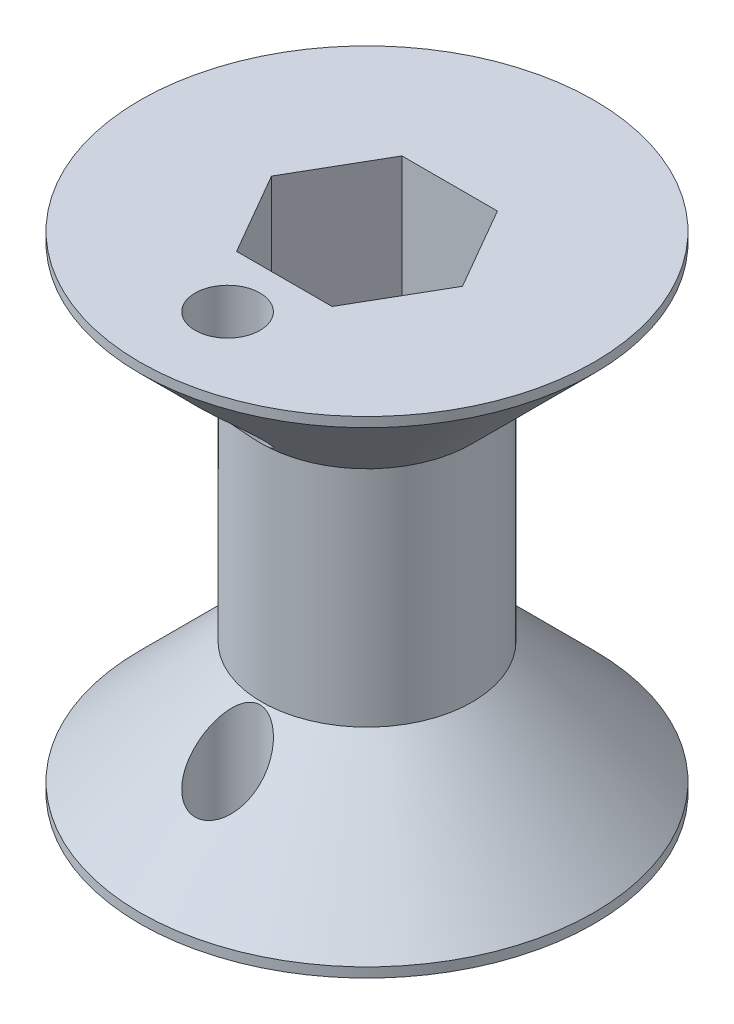
from build123d import *

# Parameters (mm, degrees)
SKETCH2_R          = 2.54
CUT_EXTRUDE1_DEPTH = 46.649389919


with BuildPart() as part:
    # Sketch1 → Revolve1 (revolve)
    with BuildSketch(Plane(origin=(0, 0, 0), x_dir=(0, 0, -1), z_dir=(1, 0, 0))):
        Polygon((0, 0), (0, 19.05), (17.78, 19.05), (17.78, 18.288), (8.255, 8.763), (8.255, 0), align=None)
    revolve1 = revolve(axis=Axis((0, 0, 0), (0, 1, 0)))

    # Mirror1: Revolve1 across plane
    add(revolve1.mirror(Plane(origin=(0, 0, -8.255), x_dir=(0, 0, 1), z_dir=(0, -1, 0))))

    # Sketch2 → Cut-Extrude1 (cut, through all)
    with BuildSketch(Plane(origin=(0, 19.05, 0), x_dir=(1, 0, 0), z_dir=(0, 1, 0))):
        with Locations((0, -10.922)):
            Circle(SKETCH2_R)
        Polygon((-7.478995387, 0), (-3.739497694, -6.477), (3.739497694, -6.477), (7.478995387, 0), (3.739497694, 6.477), (-3.739497694, 6.477), align=None)
    extrude(amount=-CUT_EXTRUDE1_DEPTH, mode=Mode.SUBTRACT)


solid = part.part
